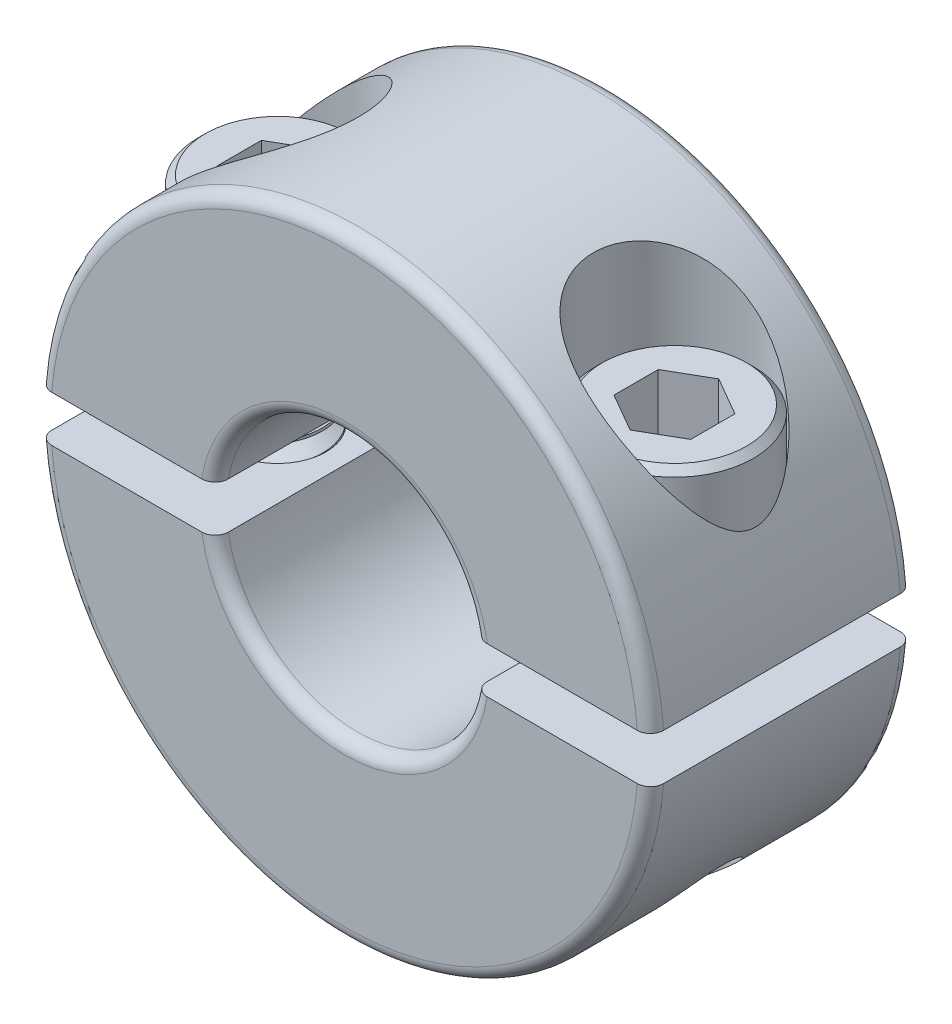
from build123d import *

# Parameters (mm, degrees)
BOSS_EXTRUDE1_DEPTH   = 4.7625
BOSS_EXTRUDE1_2_DEPTH = 4.7625
FILLET1_R             = 0.47625
FILLET2_R             = 0.47625
CUT_EXTRUDE2_DEPTH    = 2.6289
CHAMFER3_SIZE         = 0.5953125
CHAMFER1_SIZE         = 0.254
LPATTERN2_COUNT       = 2
LPATTERN2_PITCH       = 14.3764
CUT_SWEEP1_PITCH      = 0.79375
CUT_SWEEP1_TO         = 9.525
LPATTERN1_COUNT       = 2
LPATTERN1_PITCH       = 14.3764


with BuildPart() as part:
    # Sketch10 → Boss-Extrude1 (new, symmetric)
    with BuildSketch(Plane.XY):
        with BuildLine():
            Line((-4.689007164, -0.8334375), (-11.081202019, -0.8334375))
            ThreePointArc((-11.081202019, -0.8334375), (0, -11.1125), (11.081202019, -0.8334375))
            Line((11.081202019, -0.8334375), (4.689007164, -0.8334375))
            ThreePointArc((4.689007164, -0.8334375), (0, -4.7625), (-4.689007164, -0.8334375))
        make_face()
    extrude(amount=BOSS_EXTRUDE1_DEPTH, both=True)

    # Fillet2
    fillet2_edges = [part.edges().sort_by_distance(p)[0] for p in [
        (0, -4.7625, 4.7625),
        (0, -11.1125, 4.7625),
        (0, -4.7625, -4.7625),
        (0, -11.1125, -4.7625),
    ]]
    fillet(fillet2_edges, radius=FILLET2_R)


with BuildPart() as body_2:
    # Sketch10 → Boss-Extrude1 2 (new, symmetric)
    with BuildSketch(Plane.XY):
        with BuildLine():
            Line((-11.081202019, 0.8334375), (-4.689007164, 0.8334375))
            ThreePointArc((-4.689007164, 0.8334375), (0, 4.7625), (4.689007164, 0.8334375))
            Line((4.689007164, 0.8334375), (11.081202019, 0.8334375))
            ThreePointArc((11.081202019, 0.8334375), (0, 11.1125), (-11.081202019, 0.8334375))
        make_face()
    extrude(amount=BOSS_EXTRUDE1_2_DEPTH, both=True)

    # Fillet1
    fillet1_edges = [body_2.edges().sort_by_distance(p)[0] for p in [
        (0, 4.7625, 4.7625),
        (0, 11.1125, 4.7625),
        (0, 4.7625, -4.7625),
        (0, 11.1125, -4.7625),
    ]]
    fillet(fillet1_edges, radius=FILLET1_R)


with BuildPart() as cut_revolve1_tool:
    # Sketch2 → Cut-Revolve1 (revolve)
    with BuildSketch(Plane(origin=(0, 0, 0), x_dir=(1, 0, 0), z_dir=(0, 1, 0))):
        with BuildLine():
            Line((-8.128, 4.7625), (-7.747, 4.7625))
            ThreePointArc((-7.747, 4.7625), (-7.9375, 4.572), (-8.128, 4.7625))
        make_face()
    revolve(axis=Axis((0, 0, -4.7625), (0, 0, 1)))


with BuildPart() as part_1:
    add(part.part)

    # Cut-Revolve1: cut by cut_revolve1_tool
    add(cut_revolve1_tool.part, mode=Mode.SUBTRACT)


with BuildPart() as body_2_1:
    add(body_2.part)

    # Cut-Revolve1: cut by cut_revolve1_tool
    add(cut_revolve1_tool.part, mode=Mode.SUBTRACT)


with BuildPart() as cut_revolve2_tool:
    # Sketch3 → Cut-Revolve2 (revolve)
    with BuildSketch(Plane.XY):
        Polygon((-7.1882, 11.1125), (-4.2545, 11.1125), (-4.2545, 3.4623375), (-5.4356, 3.4623375), (-5.4356, -11.1125), (-7.1882, -11.1125), align=None)
    cut_revolve2 = revolve(axis=Axis((-7.1882, -11.1125, 0), (0, 1, 0)))


with BuildPart() as part_2:
    add(part_1.part)

    # Cut-Revolve2: cut by cut_revolve2_tool
    add(cut_revolve2_tool.part, mode=Mode.SUBTRACT)


with BuildPart() as body_2_2:
    add(body_2_1.part)

    # Cut-Revolve2: cut by cut_revolve2_tool
    add(cut_revolve2_tool.part, mode=Mode.SUBTRACT)


with BuildPart() as mirror1_tool:
    # Mirror1: Cut-Revolve2 across plane
    add(cut_revolve2.mirror(Plane(origin=(0, 0, 0), x_dir=(0, 0, 1), z_dir=(1, 0, 0))))


with BuildPart() as part_3:
    add(part_2.part)

    # Mirror1: cut by mirror1_tool
    add(mirror1_tool.part, mode=Mode.SUBTRACT)


with BuildPart() as body_2_3:
    add(body_2_2.part)

    # Mirror1: cut by mirror1_tool
    add(mirror1_tool.part, mode=Mode.SUBTRACT)


with BuildPart() as body_3:
    # Sketch4 → Revolve1 (revolve)
    with BuildSketch(Plane.XY, mode=Mode.PRIVATE) as revolve1_sk:
        Polygon((-7.1882, 6.9675375), (-4.318, 6.9675375), (-4.318, 3.4623375), (-5.4356, 3.4623375), (-5.4356, -6.0626625), (-7.1882, -6.0626625), align=None)
    revolve(revolve1_sk.sketch.rotate(Axis((-7.1882, -6.0626625, 0), (0, 1, 0)), 90), axis=Axis((-7.1882, -6.0626625, 0), (0, 1, 0)))

    # Sketch5 → Cut-Extrude2 (cut)
    with BuildSketch(Plane(origin=(0, 6.9675375, 0), x_dir=(-1, 0, 0), z_dir=(0, 1, 0))):
        Polygon((7.1882, 1.603951217), (5.7991375, 0.801975608), (5.7991375, -0.801975608), (7.1882, -1.603951217), (8.5772625, -0.801975608), (8.5772625, 0.801975608), align=None)
    extrude(amount=-CUT_EXTRUDE2_DEPTH, mode=Mode.SUBTRACT)

    # Chamfer3
    chamfer3_edges = [body_3.edges().sort_by_distance(p)[0] for p in [
        (-7.1882, -6.0626625, 1.7526),
    ]]
    chamfer(chamfer3_edges, length=CHAMFER3_SIZE)

    # Chamfer1
    chamfer1_edges = [body_3.edges().sort_by_distance(p)[0] for p in [
        (-7.1882, 6.9675375, 2.8702),
    ]]
    chamfer(chamfer1_edges, length=CHAMFER1_SIZE)


with BuildPart() as lpattern2_1:
    # LPattern2: pattern copy
    add(body_3.part.moved(Location(Vector(1, 0, 0) * (1 * LPATTERN2_PITCH))))


with BuildPart() as body_3_1:
    add(body_3.part)

    # Cut-Sweep1: arcs per turn and ends read off the stored shape
    # Cut-Sweep1: the profile of Sketch7 screwed along a right-hand helix through 13 turns, 8 arcs to a turn; built about Z, then put on its axis
    cut_sweep1_z = Axis((0, 0, 0), (0, 0, 1))
    cut_sweep1_corners = [(1.237044252, 0, -0.29765625), (1.237044252, 0, -0.396875), (1.795562979, 0, -0.719335937), (1.795562979, 0, 0.024804688)]
    with BuildLine(mode=Mode.PRIVATE) as cut_sweep1_profile:
        Line(cut_sweep1_corners[0], cut_sweep1_corners[1])
        Line(cut_sweep1_corners[1], cut_sweep1_corners[2])
        Line(cut_sweep1_corners[2], cut_sweep1_corners[3])
        Line(cut_sweep1_corners[3], cut_sweep1_corners[0])
    cut_sweep1_cap = Face(cut_sweep1_profile.wire())
    cut_sweep1_turn_angles = [0, 22.5, 45, 67.5, 90, 112.5, 135, 157.5, 180, 202.5, 225, 247.5, 270, 292.5, 315, 337.5, 360]
    cut_sweep1_turn_weights = [1, 0.9238795325112867, 1, 0.9238795325112867, 1, 0.9238795325112867, 1, 0.9238795325112867, 1, 0.9238795325112867, 1, 0.9238795325112867, 1, 0.9238795325112867, 1, 0.9238795325112867, 1]
    cut_sweep1_turn_rails = [Edge.make_bspline([Vector(p[0], p[1], 0).rotate(cut_sweep1_z, cut_sweep1_turn_angles[k]) / cut_sweep1_turn_weights[k] + Vector(0, 0, p[2] + CUT_SWEEP1_PITCH * cut_sweep1_turn_angles[k] / 360) for k in range(17)], [0, 0, 0, 1, 1, 2, 2, 3, 3, 4, 4, 5, 5, 6, 6, 7, 7, 8, 8, 8], 2, cut_sweep1_turn_weights) for p in cut_sweep1_corners]
    cut_sweep1_turn_sides = [Face.make_surface_from_curves(cut_sweep1_turn_rails[p[0]], cut_sweep1_turn_rails[p[1]]) for p in [(0, 1), (1, 2), (2, 3), (3, 0)]]
    cut_sweep1 = Plane(origin=(-7.1882, -6.0626625, 0), x_dir=(-1, 0, 0), z_dir=(0, 1, 0)) * split(Solid(Shell([*[p.moved(Location((0, 0, CUT_SWEEP1_PITCH * i))) for i in range(13) for p in cut_sweep1_turn_sides], cut_sweep1_cap, cut_sweep1_cap.rotate(cut_sweep1_z, 4680).moved(Location((0, 0, CUT_SWEEP1_PITCH * 4680 / 360)))])), bisect_by=Plane.XY.offset(CUT_SWEEP1_TO), keep=Keep.BOTTOM, mode=Mode.PRIVATE)
    add(cut_sweep1, mode=Mode.SUBTRACT)


with BuildPart() as lpattern1_1:
    # LPattern1: pattern copy
    add(body_3_1.part.moved(Location(Vector(1, 0, 0) * (1 * LPATTERN1_PITCH))))


solid = Compound([part_3.part, body_2_3.part, body_3_1.part, lpattern1_1.part])
